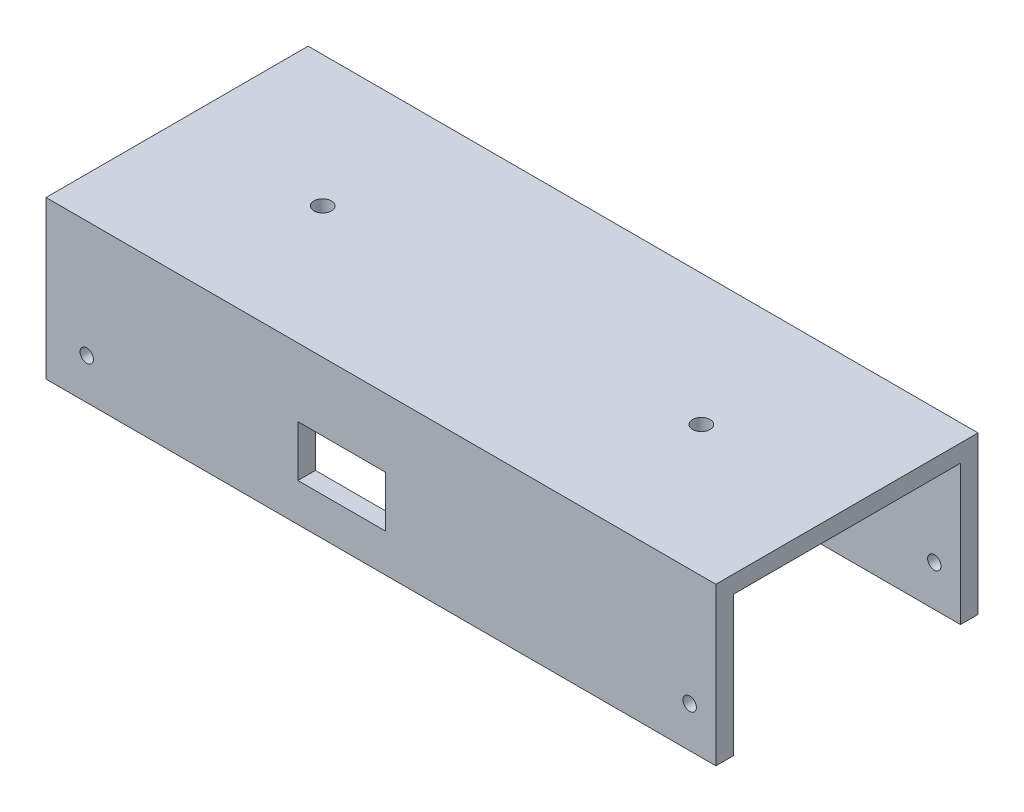
from build123d import *

# Parameters (mm, degrees)
SKETCH1_W           = 115
SKETCH1_H           = 27
BOSS_EXTRUDE5_DEPTH = 45
SHELL9_T            = -3
SKETCH3_R           = 1.15
CUT_EXTRUDE2_DEPTH  = 79
CUT_EXTRUDE8_DEPTH  = 23
SKETCH7_W           = 15
SKETCH7_H           = 8.75
CUT_EXTRUDE9_DEPTH  = 20
CUT_EXTRUDE10_DEPTH = 1
SKETCH10_R          = 1.5
CUT_EXTRUDE11_DEPTH = 26


with BuildPart() as part:
    # Sketch1 → Boss-Extrude5 (new body)
    with BuildSketch(Plane.XY):
        with Locations((57.5, 13.5)):
            Rectangle(SKETCH1_W, SKETCH1_H)
    extrude(amount=BOSS_EXTRUDE5_DEPTH)

    # Shell9
    shell9_openings = [part.faces().sort_by_distance(p)[0] for p in [
        (115, 13.5, 22.5),
        (57.5, 0, 22.5),
        (0, 13.5, 22.5),
    ]]
    offset(amount=SHELL9_T, openings=shell9_openings, kind=Kind.INTERSECTION)

    # Sketch3 → Cut-Extrude2 (cut)
    with BuildSketch(Plane(origin=(0, 0, 0), x_dir=(-1, 0, 0), z_dir=(0, 0, -1))):
        with Locations((-7, 7)):
            Circle(SKETCH3_R)
        with Locations((-110.5, 7)):
            Circle(SKETCH3_R)
    extrude(amount=-CUT_EXTRUDE2_DEPTH, mode=Mode.SUBTRACT)

    # Sketch6 → Cut-Extrude8 (cut)
    with BuildSketch(Plane(origin=(0, 0, 0), x_dir=(-1, 0, 0), z_dir=(0, 0, -1))):
        with BuildLine():
            Line((-46.883496676, 21.743762355), (-71.973496676, 21.743762355))
            ThreePointArc((-71.973496676, 21.743762355), (-73.723496676, 19.993762355), (-71.973496676, 18.243762355))
            Line((-71.973496676, 18.243762355), (-46.883496676, 18.243762355))
            ThreePointArc((-46.883496676, 18.243762355), (-45.133496676, 19.993762355), (-46.883496676, 21.743762355))
        make_face()
        with BuildLine():
            Line((-14.873496676, 15.993762355), (-89.873496676, 15.993762355))
            ThreePointArc((-89.873496676, 15.993762355), (-94.373496676, 11.493762355), (-89.873496676, 6.993762355))
            Line((-89.873496676, 6.993762355), (-14.873496676, 6.993762355))
            ThreePointArc((-14.873496676, 6.993762355), (-10.373496676, 11.493762355), (-14.873496676, 15.993762355))
        make_face()
        with BuildLine():
            ThreePointArc((-71.973496676, 4.743762355), (-73.723496676, 2.993762355), (-71.973496676, 1.243762355))
            Line((-71.973496676, 1.243762355), (-46.883496676, 1.243762355))
            ThreePointArc((-46.883496676, 1.243762355), (-45.133496676, 2.993762355), (-46.883496676, 4.743762355))
            Line((-46.883496676, 4.743762355), (-71.973496676, 4.743762355))
        make_face()
    extrude(amount=-CUT_EXTRUDE8_DEPTH, mode=Mode.SUBTRACT)

    # Sketch7 → Cut-Extrude9 (cut)
    with BuildSketch(Plane.XY.offset(45)):
        with Locations((50.746172795, 10.921245049)):
            Rectangle(SKETCH7_W, SKETCH7_H)
    extrude(amount=-CUT_EXTRUDE9_DEPTH, mode=Mode.SUBTRACT)

    # Sketch9 → Cut-Extrude10 (cut)
    # profile 1 of 6: a face of its own
    with BuildSketch(Plane.XZ.offset(-24)):
        with BuildLine():
            Line((2.360897436, 22.428821238), (2.645833333, 22.428821238))
            Line((2.645833333, 22.428821238), (2.645833333, 20.587550205))
            add(Edge.make_bspline(
                [(2.645833333, 20.587550205), (2.645582016, 20.54832753), (2.645096913, 20.472618319), (2.641603532, 20.363145879), (2.634236918, 20.262030216), (2.625883329, 20.168810167), (2.613866664, 20.083917824), (2.599192388, 20.007099874), (2.582650022, 19.9382826), (2.568117397, 19.895896494), (2.561242989, 19.875846479)],
                knots=[0, 0, 0, 0, 1.307562039, 2.523909702, 3.650326591, 4.686913197, 5.643429486, 6.506965704, 7.293745905, 8, 8, 8, 8], degree=3))
            add(Edge.make_bspline(
                [(2.561242989, 19.875846479), (2.551092751, 19.849784336), (2.53109576, 19.79843929), (2.493643793, 19.725655299), (2.451703037, 19.657123932), (2.403799771, 19.593227101), (2.350150613, 19.534285573), (2.292019545, 19.479018802), (2.228274443, 19.428596022), (2.158951754, 19.383887216), (2.085649501, 19.343621817), (2.008409823, 19.308745288), (1.927668268, 19.278367937), (1.842666359, 19.255614258), (1.754736789, 19.235897762), (1.662845548, 19.223066511), (1.567529511, 19.214333394), (1.502718345, 19.213525826), (1.469836739, 19.21311611)],
                knots=[0, 0, 0, 0, 0.981931301, 1.934503488, 2.87077864, 3.801706999, 4.735015492, 5.667491629, 6.616593066, 7.585388521, 8.561939025, 9.551802639, 10.560317337, 11.588439944, 12.640189604, 13.723962949, 14.845264515, 16, 16, 16, 16], degree=3))
            add(Edge.make_bspline(
                [(1.469836739, 19.21311611), (1.42186273, 19.213893065), (1.3281566, 19.215410667), (1.191536357, 19.233091711), (1.061783432, 19.258087464), (0.940612318, 19.295920245), (0.82878873, 19.342218085), (0.727076357, 19.395372079), (0.636388281, 19.45632238), (0.554633235, 19.525719354), (0.480844793, 19.608236408), (0.411423608, 19.705481074), (0.344602611, 19.818934609), (0.305442489, 19.902203713), (0.284935897, 19.945808418)],
                knots=[0, 0, 0, 0, 1.157897085, 2.2616841, 3.32207898, 4.345638746, 5.321241055, 6.241986252, 7.112515963, 7.955008012, 8.825025602, 9.77857164, 10.836726669, 12, 12, 12, 12], degree=3))
            Line((0.284935897, 19.945808418), (0.569871795, 19.945808418))
            add(Edge.make_bspline(
                [(0.569871795, 19.945808418), (0.592788228, 19.909426659), (0.637587032, 19.838304801), (0.721360297, 19.746217866), (0.813168893, 19.667520171), (0.916111177, 19.604101112), (1.030615479, 19.556285801), (1.156750687, 19.522199639), (1.295543201, 19.501792312), (1.392170438, 19.499332781), (1.442487981, 19.498052008)],
                knots=[0, 0, 0, 0, 0.997731894, 1.950442991, 2.880492273, 3.800895997, 4.748200782, 5.754801363, 6.83083817, 8, 8, 8, 8], degree=3))
            add(Edge.make_bspline(
                [(1.442487981, 19.498052008), (1.492169374, 19.499349357), (1.587950128, 19.501850516), (1.725682688, 19.522208747), (1.851408096, 19.556293219), (1.964401993, 19.604016541), (2.063331154, 19.662482267), (2.14861346, 19.72779662), (2.217687559, 19.801439387), (2.264145036, 19.869277168), (2.293023582, 19.929714772), (2.311413397, 19.981741769), (2.326357641, 20.040572594), (2.338857922, 20.106010012), (2.349172965, 20.178147515), (2.355707008, 20.257150045), (2.360429423, 20.342838054), (2.360737824, 20.402249687), (2.360897436, 20.432997921)],
                knots=[0, 0, 0, 0, 1.570740765, 3.028230971, 4.391408896, 5.680370741, 6.894727393, 8.017376726, 9.065722033, 10.075533815, 10.603371122, 11.180248986, 11.817768598, 12.521299649, 13.286540596, 14.121245857, 15.027658897, 16, 16, 16, 16], degree=3))
            Line((2.360897436, 20.432997921), (2.360897436, 20.553205253))
            add(Edge.make_bspline(
                [(2.360897436, 20.553205253), (2.331976708, 20.518786618), (2.274643959, 20.450554761), (2.175631741, 20.361145277), (2.067484967, 20.28414143), (1.950387754, 20.220987383), (1.82720842, 20.170476376), (1.699281111, 20.135149548), (1.567752604, 20.112325924), (1.478623868, 20.109870002), (1.433583734, 20.108628931)],
                knots=[0, 0, 0, 0, 1.012485704, 2.007162095, 2.997754123, 3.998611389, 4.999708251, 5.992315798, 6.98544096, 8, 8, 8, 8], degree=3))
            add(Edge.make_bspline(
                [(1.433583734, 20.108628931), (1.407062261, 20.109096133), (1.35433317, 20.110025009), (1.275997077, 20.1181519), (1.198816965, 20.129943617), (1.122972834, 20.147253208), (1.048355242, 20.169470703), (0.975087498, 20.197244458), (0.902576371, 20.228645316), (0.832139905, 20.265632073), (0.764479629, 20.306782166), (0.700105882, 20.351358159), (0.63935585, 20.399126749), (0.582807749, 20.450558973), (0.530535754, 20.505580392), (0.481836817, 20.563604473), (0.437516224, 20.625441445), (0.396664506, 20.689963757), (0.361233728, 20.757601166), (0.330132905, 20.82688701), (0.303091517, 20.89767314), (0.281532902, 20.970196547), (0.265067249, 21.044411509), (0.252811543, 21.120196444), (0.24586017, 21.197784725), (0.244776203, 21.25005552), (0.244230769, 21.276357296)],
                knots=[0, 0, 0, 0, 1.028754217, 2.045334182, 3.052854819, 4.056607503, 5.061168794, 6.071104265, 7.095078842, 8.125279047, 9.155117945, 10.165957491, 11.161587969, 12.151493252, 13.128948131, 14.104219989, 15.088194871, 16.07871515, 17.064853787, 18.047899887, 19.02414258, 20.002704429, 20.980574569, 21.971845993, 22.979467364, 24, 24, 24, 24], degree=3))
            add(Edge.make_bspline(
                [(0.244230769, 21.276357296), (0.244701727, 21.302667247), (0.245641819, 21.355185248), (0.253761636, 21.433090119), (0.265344208, 21.509951821), (0.283675541, 21.584978107), (0.305739544, 21.659023417), (0.333065927, 21.731540831), (0.365921516, 21.802552436), (0.403123218, 21.872110818), (0.444928073, 21.939282583), (0.490768252, 22.003078897), (0.540699095, 22.06303031), (0.594031762, 22.119741636), (0.651417453, 22.172665705), (0.712826482, 22.221674066), (0.777653523, 22.267588218), (0.846099493, 22.309417788), (0.917108266, 22.346413112), (0.988875801, 22.380170253), (1.062352772, 22.406961919), (1.136169289, 22.430568587), (1.211625355, 22.447291943), (1.287795776, 22.460193548), (1.364941326, 22.468053688), (1.416605737, 22.46903484), (1.442487981, 22.469526366)],
                knots=[0, 0, 0, 0, 1.008818848, 2.013730394, 3.001654427, 3.987803273, 4.973046549, 5.963777569, 6.957074694, 7.972068341, 8.987420212, 9.989399531, 10.982630087, 11.977756091, 12.973280677, 13.973972381, 14.989194003, 16.018387222, 17.047741039, 18.059210846, 19.057554164, 20.045176975, 21.029480261, 22.018708529, 23.007435371, 24, 24, 24, 24], degree=3))
            add(Edge.make_bspline(
                [(1.442487981, 22.469526366), (1.485169904, 22.46829567), (1.569453588, 22.465865423), (1.69348814, 22.446796241), (1.8131786, 22.416394243), (1.929200372, 22.372837207), (2.042498569, 22.313373958), (2.152699785, 22.235048569), (2.260122857, 22.137158475), (2.326414889, 22.062089805), (2.360897436, 22.023041991)],
                knots=[0, 0, 0, 0, 0.96728863, 1.910097829, 2.838038873, 3.762875196, 4.71315279, 5.730631239, 6.819562287, 8, 8, 8, 8], degree=3))
            Line((2.360897436, 22.023041991), (2.360897436, 22.428821238))
        make_face()
        with BuildLine():
            add(Edge.make_bspline(
                [(1.465384615, 22.184590469), (1.423718905, 22.18317436), (1.341229635, 22.180370763), (1.220318067, 22.156436059), (1.103589706, 22.118929421), (0.99327621, 22.06527862), (0.889946189, 21.999878847), (0.798256888, 21.920648729), (0.718060999, 21.830164679), (0.650222191, 21.729244812), (0.596218737, 21.620367462), (0.557988635, 21.505604153), (0.533268971, 21.386809267), (0.530540601, 21.305735549), (0.529166667, 21.264908979)],
                knots=[0, 0, 0, 0, 1.026226791, 2.031711442, 3.026614839, 4.04107745, 5.047145931, 6.032893242, 7.017642609, 8.019221815, 9.021877557, 10.003543541, 10.994637589, 12, 12, 12, 12], degree=3))
            add(Edge.make_bspline(
                [(0.529166667, 21.264908979), (0.529825032, 21.234126653), (0.531119843, 21.17358682), (0.543569089, 21.084743158), (0.563690393, 21.000124588), (0.59220843, 20.919725991), (0.627544089, 20.843086213), (0.671987169, 20.770733193), (0.724284836, 20.702602495), (0.784027757, 20.639198034), (0.849864903, 20.581448441), (0.921274462, 20.530704647), (0.998159582, 20.489202207), (1.078629331, 20.453333019), (1.164636231, 20.427135579), (1.254941473, 20.407143258), (1.350183941, 20.395705313), (1.415109733, 20.394287632), (1.448212139, 20.393564828)],
                knots=[0, 0, 0, 0, 1.039728707, 2.044842319, 3.024901384, 3.974314358, 4.923051295, 5.871625912, 6.837440708, 7.820715446, 8.810779094, 9.792721783, 10.773906224, 11.758876063, 12.764959493, 13.806266761, 14.881525401, 16, 16, 16, 16], degree=3))
            add(Edge.make_bspline(
                [(1.448212139, 20.393564828), (1.481743549, 20.394261159), (1.547313864, 20.395622827), (1.643081785, 20.407328144), (1.733825771, 20.426216651), (1.819462617, 20.453034538), (1.900315662, 20.487253555), (1.975476634, 20.530557486), (2.046557126, 20.579873792), (2.111287583, 20.637397548), (2.169820219, 20.700793222), (2.220829558, 20.769776806), (2.264294808, 20.843310276), (2.300288123, 20.921385346), (2.327766572, 21.004608766), (2.346198722, 21.092772489), (2.359086269, 21.185454131), (2.360284536, 21.248961947), (2.360897436, 21.281445437)],
                knots=[0, 0, 0, 0, 1.121943988, 2.193949579, 3.223793937, 4.220241907, 5.192961521, 6.155822191, 7.11847367, 8.083710714, 9.04790392, 10.001595906, 10.949595423, 11.902125208, 12.873731292, 13.87582262, 14.913508608, 16, 16, 16, 16], degree=3))
            add(Edge.make_bspline(
                [(2.360897436, 21.281445437), (2.359682256, 21.32373449), (2.357308222, 21.40635244), (2.334904372, 21.526736436), (2.298781753, 21.639919448), (2.24812077, 21.745543511), (2.184637091, 21.84248946), (2.10817325, 21.928961805), (2.020047922, 22.005071868), (1.920514302, 22.068479514), (1.813428406, 22.11970173), (1.701377035, 22.158129909), (1.584526545, 22.179896181), (1.505327159, 22.1830167), (1.465384615, 22.184590469)],
                knots=[0, 0, 0, 0, 1.070913519, 2.092188694, 3.091357305, 4.074328408, 5.051968682, 6.018948707, 6.99050112, 7.9935919, 9.000589572, 9.992915277, 10.987769056, 12, 12, 12, 12], degree=3))
        make_face(mode=Mode.SUBTRACT)
    # profile 2 of 6: a face of its own
    with BuildSketch(Plane.XZ.offset(-24)):
        with BuildLine():
            Line((3.215705128, 22.428821238), (3.500641026, 22.428821238))
            Line((3.500641026, 22.428821238), (3.500641026, 22.087279772))
            add(Edge.make_bspline(
                [(3.500641026, 22.087279772), (3.521676543, 22.119080416), (3.561906805, 22.179898901), (3.628774962, 22.260334624), (3.69726727, 22.326932559), (3.767711619, 22.380003609), (3.840626038, 22.419748366), (3.914410273, 22.448861334), (3.990225163, 22.46607647), (4.041172051, 22.468374861), (4.066696715, 22.469526366)],
                knots=[0, 0, 0, 0, 1.2804753, 2.448899062, 3.506932113, 4.484331642, 5.4025378, 6.288909075, 7.142734305, 8, 8, 8, 8], degree=3))
            add(Edge.make_bspline(
                [(4.066696715, 22.469526366), (4.086496311, 22.468446389), (4.127235267, 22.466224264), (4.188905188, 22.450611588), (4.252444605, 22.425685096), (4.293395199, 22.402244323), (4.31474359, 22.390024163)],
                knots=[0, 0, 0, 0, 0.901110191, 1.854092781, 2.881294221, 4, 4, 4, 4], degree=3))
            Line((4.31474359, 22.390024163), (4.158283253, 22.143249323))
            add(Edge.make_bspline(
                [(4.158283253, 22.143249323), (4.144577213, 22.149363707), (4.118560524, 22.160969979), (4.080501739, 22.174705946), (4.04541224, 22.182793955), (4.023057012, 22.184019249), (4.012635216, 22.184590469)],
                knots=[0, 0, 0, 0, 1.180555205, 2.24091978, 3.179933427, 4, 4, 4, 4], degree=3))
            add(Edge.make_bspline(
                [(4.012635216, 22.184590469), (3.989770015, 22.183066435), (3.943131633, 22.179957848), (3.874656408, 22.155520501), (3.808210729, 22.11603689), (3.755440721, 22.072248096), (3.714580963, 22.030022594), (3.685425187, 21.993148686), (3.658680124, 21.951802356), (3.63312571, 21.906690428), (3.609842714, 21.857042639), (3.588112407, 21.80335501), (3.568464724, 21.745565357), (3.557261289, 21.705304071), (3.551522436, 21.684680613)],
                knots=[0, 0, 0, 0, 1.125678352, 2.296057538, 3.5422874, 4.923748041, 5.663163013, 6.437101912, 7.23742474, 8.08941207, 8.991984279, 9.93940061, 10.944477711, 12, 12, 12, 12], degree=3))
            add(Edge.make_bspline(
                [(3.551522436, 21.684680613), (3.547229479, 21.66628632), (3.537720906, 21.625544358), (3.528475725, 21.557192482), (3.519341234, 21.476435306), (3.512903587, 21.38304804), (3.506936363, 21.277263894), (3.503570789, 21.158921715), (3.500755797, 21.027900032), (3.500680443, 20.936301869), (3.500641026, 20.888386543)],
                knots=[0, 0, 0, 0, 0.566838948, 1.255505196, 2.06880316, 3.007127437, 4.065329342, 5.249902469, 6.561414163, 8, 8, 8, 8], degree=3))
            Line((3.500641026, 20.888386543), (3.500641026, 20.108628931))
            Line((3.500641026, 20.108628931), (3.215705128, 20.108628931))
            Line((3.215705128, 20.108628931), (3.215705128, 22.428821238))
        make_face()
    # profile 3 of 6: a face of its own
    with BuildSketch(Plane.XZ.offset(-24)):
        with BuildLine():
            add(Edge.make_bspline(
                [(5.720342548, 22.469526366), (5.763877488, 22.468599365), (5.849238867, 22.466781742), (5.974250306, 22.447355309), (6.093580537, 22.417648772), (6.207686583, 22.376580997), (6.315107079, 22.321533799), (6.417406708, 22.255848228), (6.514304994, 22.178031161), (6.572383028, 22.117834913), (6.601862981, 22.087279772)],
                knots=[0, 0, 0, 0, 1.054011418, 2.066658804, 3.057071809, 4.030435133, 4.997543892, 5.974964718, 6.972108034, 8, 8, 8, 8], degree=3))
            add(Edge.make_bspline(
                [(6.601862981, 22.087279772), (6.627246611, 22.058057085), (6.677522627, 22.00017725), (6.741989386, 21.90632823), (6.797526087, 21.809136853), (6.842033202, 21.707312492), (6.877126045, 21.60174404), (6.902041355, 21.492068645), (6.916861289, 21.378528515), (6.918859694, 21.301417891), (6.919871795, 21.262364908)],
                knots=[0, 0, 0, 0, 1.025258237, 2.030674902, 3.01204498, 3.988269485, 4.97094183, 5.956517959, 6.965070386, 8, 8, 8, 8], degree=3))
            add(Edge.make_bspline(
                [(6.919871795, 21.262364908), (6.918981582, 21.22308557), (6.917222479, 21.145467766), (6.900582198, 21.031150199), (6.874700428, 20.920302038), (6.837660117, 20.813387366), (6.790163833, 20.710079373), (6.732205852, 20.610829281), (6.663379456, 20.515441275), (6.585361545, 20.424725322), (6.499135914, 20.341117398), (6.405594837, 20.268248182), (6.306576535, 20.205817228), (6.20076435, 20.155528479), (6.089124558, 20.115877537), (5.971416361, 20.088028236), (5.847822619, 20.071190138), (5.763433639, 20.069027896), (5.720342548, 20.067923802)],
                knots=[0, 0, 0, 0, 0.998656419, 1.973391657, 2.932242238, 3.890759089, 4.846373663, 5.82037756, 6.809684879, 7.83454468, 8.860553229, 9.859544525, 10.845671541, 11.83227036, 12.833544569, 13.85385346, 14.904124723, 16, 16, 16, 16], degree=3))
            add(Edge.make_bspline(
                [(5.720342548, 20.067923802), (5.677040338, 20.069031602), (5.592230773, 20.071201283), (5.468200775, 20.087962818), (5.35028162, 20.115864702), (5.238495677, 20.155658785), (5.132228566, 20.205818835), (5.03263653, 20.268059439), (4.939019464, 20.341139009), (4.852775592, 20.424719466), (4.774762571, 20.515442784), (4.705934914, 20.61082889), (4.647977261, 20.710079475), (4.60048089, 20.813387339), (4.563440603, 20.920302045), (4.537558826, 21.031150197), (4.520918547, 21.145467767), (4.519159444, 21.22308557), (4.518269231, 21.262364908)],
                knots=[0, 0, 0, 0, 1.099876186, 2.154163076, 3.173186993, 4.173200201, 5.163417411, 6.152872554, 7.150605724, 8.17532212, 9.198891216, 10.186952605, 11.159729845, 12.11414092, 13.071450619, 14.029093627, 15.002601286, 16, 16, 16, 16], degree=3))
            add(Edge.make_bspline(
                [(4.518269231, 21.262364908), (4.519288234, 21.301205632), (4.521305684, 21.37810359), (4.536110718, 21.491430281), (4.560928837, 21.600920055), (4.596063746, 21.706081022), (4.640981098, 21.807459168), (4.695737409, 21.904890693), (4.760861769, 21.998315341), (4.810937825, 22.056120371), (4.836278045, 22.085371719)],
                knots=[0, 0, 0, 0, 1.031353054, 2.041901799, 3.029428768, 4.008703097, 4.981709435, 5.96992636, 6.972712378, 8, 8, 8, 8], degree=3))
            add(Edge.make_bspline(
                [(4.836278045, 22.085371719), (4.865713552, 22.116191843), (4.923603658, 22.176805038), (5.020984289, 22.254395257), (5.123032255, 22.321447695), (5.231639867, 22.375401119), (5.345652174, 22.417890346), (5.465593915, 22.44743192), (5.591029561, 22.466711749), (5.676808646, 22.468578811), (5.720342548, 22.469526366)],
                knots=[0, 0, 0, 0, 1.027980169, 2.021703884, 2.998553061, 3.971491411, 4.943284454, 5.930300938, 6.949603206, 8, 8, 8, 8], degree=3))
        make_face()
        with BuildLine():
            add(Edge.make_bspline(
                [(5.719070513, 22.184590469), (5.688284251, 22.183715447), (5.62750647, 22.18198799), (5.538044418, 22.16884902), (5.451920136, 22.148032355), (5.368970227, 22.118455818), (5.289474421, 22.080266103), (5.213356606, 22.033359233), (5.140392892, 21.97835648), (5.072010592, 21.915343914), (5.009252352, 21.846510826), (4.954390187, 21.773169814), (4.907740269, 21.696510486), (4.868878125, 21.616453123), (4.839933747, 21.532186433), (4.818912506, 21.444664718), (4.80578593, 21.353709661), (4.804074715, 21.291877881), (4.803205128, 21.260456855)],
                knots=[0, 0, 0, 0, 1.021534396, 2.016698045, 2.994645724, 3.958388632, 4.93408049, 5.916473867, 6.921342795, 7.962252576, 8.998418191, 10.008913653, 10.997312074, 11.973003931, 12.956656626, 13.948281152, 14.957379055, 16, 16, 16, 16], degree=3))
            add(Edge.make_bspline(
                [(4.803205128, 21.260456855), (4.804662747, 21.219860373), (4.807555847, 21.139283948), (4.831082812, 21.020619573), (4.870440365, 20.906698893), (4.923587398, 20.798189743), (4.990177325, 20.697794176), (5.06863345, 20.608285044), (5.158113749, 20.531009343), (5.257551574, 20.466891719), (5.364915848, 20.415946798), (5.478541225, 20.379843442), (5.597050998, 20.356374121), (5.678041375, 20.354041426), (5.719070513, 20.3528597)],
                knots=[0, 0, 0, 0, 1.016792936, 2.018143844, 3.017858371, 4.030088057, 5.03801393, 6.028138512, 7.003788237, 7.991172063, 8.984598303, 9.972568034, 10.972917682, 12, 12, 12, 12], degree=3))
            add(Edge.make_bspline(
                [(5.719070513, 20.3528597), (5.76009729, 20.354048311), (5.84108301, 20.356394597), (5.95942812, 20.379725241), (6.072742937, 20.41610499), (6.179995696, 20.466834423), (6.279388258, 20.531252828), (6.369512103, 20.607848684), (6.447298344, 20.69803125), (6.513822399, 20.798322722), (6.567839802, 20.90653067), (6.607013135, 21.020640599), (6.630596659, 21.139278594), (6.633482125, 21.219858579), (6.634935897, 21.260456855)],
                knots=[0, 0, 0, 0, 1.02726834, 2.027799167, 3.010890988, 4.004497153, 4.992059811, 5.971914811, 6.958719428, 7.966827853, 8.981595046, 9.981490638, 10.983022906, 12, 12, 12, 12], degree=3))
            add(Edge.make_bspline(
                [(6.634935897, 21.260456855), (6.63406661, 21.291878068), (6.632355984, 21.353710219), (6.619225123, 21.444662587), (6.598219741, 21.53219425), (6.569216917, 21.616424282), (6.530523633, 21.696717768), (6.482974113, 21.772944734), (6.428335969, 21.846764887), (6.364820438, 21.915121404), (6.296509516, 21.978381044), (6.223516232, 22.033380562), (6.147511287, 22.080059952), (6.06824643, 22.11878247), (5.985285886, 22.147763272), (5.899282276, 22.168969216), (5.810201927, 22.181932466), (5.749641938, 22.183698801), (5.719070513, 22.184590469)],
                knots=[0, 0, 0, 0, 1.042956736, 2.052379634, 3.044323526, 4.02829302, 5.004299113, 5.996692471, 7.007513377, 8.048758398, 9.090003419, 10.095195979, 11.07790575, 12.047570684, 13.018257071, 13.989683339, 14.985167495, 16, 16, 16, 16], degree=3))
        make_face(mode=Mode.SUBTRACT)
    # profile 4 of 6: a face of its own
    with BuildSketch(Plane.XZ.offset(-24)):
        with BuildLine():
            Line((7.449038462, 22.428821238), (7.733974359, 22.428821238))
            Line((7.733974359, 22.428821238), (7.733974359, 21.352679411))
            add(Edge.make_bspline(
                [(7.733974359, 21.352679411), (7.734103087, 21.321090203), (7.734349338, 21.260661528), (7.736019334, 21.17370718), (7.739947348, 21.094407733), (7.74485846, 21.022717379), (7.751174112, 20.958648245), (7.758688303, 20.902424114), (7.767087014, 20.85340739), (7.77530819, 20.823885917), (7.779131611, 20.810156375)],
                knots=[0, 0, 0, 0, 1.388932606, 2.656963016, 3.823490214, 4.879454478, 5.816252168, 6.653371382, 7.373723809, 8, 8, 8, 8], degree=3))
            add(Edge.make_bspline(
                [(7.779131611, 20.810156375), (7.785265216, 20.792899913), (7.797404911, 20.758745748), (7.819424429, 20.70940715), (7.84666442, 20.663709572), (7.876472978, 20.619890878), (7.910853155, 20.579249075), (7.949369961, 20.541852797), (7.990734076, 20.506289086), (8.052197561, 20.464211453), (8.136252752, 20.419112547), (8.246609181, 20.380199911), (8.366265157, 20.35694456), (8.448964581, 20.354246486), (8.491471354, 20.3528597)],
                knots=[0, 0, 0, 0, 0.725840625, 1.436591201, 2.137033971, 2.831655856, 3.53531722, 4.242432219, 4.957935707, 5.694543706, 7.190802206, 8.724350549, 10.316345118, 12, 12, 12, 12], degree=3))
            add(Edge.make_bspline(
                [(8.491471354, 20.3528597), (8.533974179, 20.354275975), (8.616209281, 20.357016206), (8.734550575, 20.379498416), (8.842728643, 20.417059291), (8.939657721, 20.469498872), (9.024898161, 20.533672029), (9.095931455, 20.608972877), (9.154539465, 20.693019107), (9.180129439, 20.755724702), (9.192998798, 20.78725974)],
                knots=[0, 0, 0, 0, 1.157059328, 2.238695713, 3.266970494, 4.264342957, 5.228770407, 6.160125903, 7.074715775, 8, 8, 8, 8], degree=3))
            add(Edge.make_bspline(
                [(9.192998798, 20.78725974), (9.196803564, 20.799929168), (9.205214972, 20.827938179), (9.214252248, 20.875454094), (9.222393367, 20.932118414), (9.229344962, 20.998301932), (9.234302645, 21.073831691), (9.236975112, 21.158684089), (9.239994334, 21.252592751), (9.240040159, 21.318331362), (9.240064103, 21.352679411)],
                knots=[0, 0, 0, 0, 0.557542046, 1.232589297, 2.036731608, 2.971723315, 4.038036528, 5.22795436, 6.551621927, 8, 8, 8, 8], degree=3))
            Line((9.240064103, 21.352679411), (9.240064103, 22.428821238))
            Line((9.240064103, 22.428821238), (9.525, 22.428821238))
            Line((9.525, 22.428821238), (9.525, 21.299253931))
            add(Edge.make_bspline(
                [(9.525, 21.299253931), (9.52459932, 21.260875282), (9.523821945, 21.186415454), (9.518825998, 21.078207725), (9.510253849, 20.977367688), (9.497242985, 20.883841967), (9.481943409, 20.797701966), (9.462207361, 20.718837283), (9.438641388, 20.647490902), (9.4120571, 20.582410861), (9.38065012, 20.523404036), (9.347242751, 20.467400831), (9.308666708, 20.415790811), (9.26805371, 20.366004872), (9.222876494, 20.320519344), (9.173981622, 20.278290505), (9.122057291, 20.238672826), (9.065951233, 20.203211451), (9.006482518, 20.171264923), (8.943577734, 20.142947481), (8.8764664, 20.120538715), (8.806014386, 20.101206896), (8.731876522, 20.086044485), (8.65412428, 20.075352385), (8.572783849, 20.068797978), (8.517348839, 20.068220087), (8.488927284, 20.067923802)],
                knots=[0, 0, 0, 0, 1.493040784, 2.896703357, 4.213163133, 5.428574705, 6.569057535, 7.615249723, 8.588095153, 9.490268104, 10.346124644, 11.18633936, 12.024365274, 12.850166724, 13.684164916, 14.514361689, 15.362232829, 16.222528818, 17.093394965, 17.986930858, 18.902426812, 19.842810585, 20.827885679, 21.843828298, 22.894529745, 24, 24, 24, 24], degree=3))
            add(Edge.make_bspline(
                [(8.488927284, 20.067923802), (8.460718303, 20.068231965), (8.40528503, 20.068837534), (8.323940401, 20.075316174), (8.245972737, 20.086027872), (8.171659233, 20.101317962), (8.100925315, 20.120403404), (8.033484469, 20.143085182), (7.97012638, 20.171279619), (7.910089847, 20.203009261), (7.853844824, 20.238900618), (7.801132042, 20.278241625), (7.752022183, 20.320973554), (7.706504414, 20.366917942), (7.665217643, 20.416644734), (7.627647376, 20.469753921), (7.593215222, 20.525719273), (7.562052334, 20.585647999), (7.535280956, 20.651481179), (7.511645125, 20.724322117), (7.492313332, 20.8049694), (7.476581236, 20.893354078), (7.463925286, 20.989053152), (7.455138571, 21.092620214), (7.450225639, 21.203802992), (7.449442719, 21.280592535), (7.449038462, 21.320242512)],
                knots=[0, 0, 0, 0, 1.083640291, 2.129454052, 3.13281866, 4.105697902, 5.042300162, 5.946461698, 6.836384745, 7.703652036, 8.553297018, 9.397182691, 10.228592656, 11.052265423, 11.879314572, 12.708807002, 13.549817954, 14.402308542, 15.300838682, 16.27712199, 17.341985831, 18.484375296, 19.725102775, 21.0496083, 22.476576903, 24, 24, 24, 24], degree=3))
            Line((7.449038462, 21.320242512), (7.449038462, 22.428821238))
        make_face()
    # profile 5 of 6: a face of its own
    with BuildSketch(Plane.XZ.offset(-24)):
        with BuildLine():
            Line((10.176282051, 22.428821238), (10.461217949, 22.428821238))
            Line((10.461217949, 22.428821238), (10.461217949, 21.999509339))
            add(Edge.make_bspline(
                [(10.461217949, 21.999509339), (10.491477952, 22.038459998), (10.550282213, 22.114152808), (10.651632662, 22.212115282), (10.758609125, 22.294733593), (10.873964506, 22.359487748), (10.995905996, 22.408310913), (11.12393317, 22.444396557), (11.259132621, 22.465661323), (11.35156726, 22.468220973), (11.398707933, 22.469526366)],
                knots=[0, 0, 0, 0, 1.0828784, 2.104357462, 3.088488658, 4.04616522, 5.001424249, 5.969181776, 6.964304535, 8, 8, 8, 8], degree=3))
            add(Edge.make_bspline(
                [(11.398707933, 22.469526366), (11.439884601, 22.468335126), (11.52127245, 22.465980576), (11.641072665, 22.450039305), (11.756438906, 22.422718255), (11.866718497, 22.383347425), (11.973092849, 22.334674248), (12.073987183, 22.273245223), (12.170973051, 22.202119607), (12.261611308, 22.120266156), (12.345359977, 22.031703372), (12.41779187, 21.936433139), (12.480268526, 21.837588507), (12.530769438, 21.733637109), (12.570328439, 21.625397522), (12.598463182, 21.512432436), (12.615206902, 21.39516069), (12.617453397, 21.315420365), (12.618589744, 21.275085261)],
                knots=[0, 0, 0, 0, 1.041296284, 2.058176809, 3.050446431, 4.034000596, 5.01514041, 6.003636468, 7.015969324, 8.052561599, 9.08815499, 10.094063707, 11.074456064, 12.040834395, 13.011057502, 13.983766392, 14.980127149, 16, 16, 16, 16], degree=3))
            add(Edge.make_bspline(
                [(12.618589744, 21.275085261), (12.617478053, 21.233898881), (12.615285639, 21.152673396), (12.598281241, 21.033395815), (12.571106076, 20.918653697), (12.532046153, 20.808637894), (12.481571374, 20.703424153), (12.420153666, 20.603088351), (12.347685228, 20.507662635), (12.264862062, 20.418442504), (12.175006899, 20.336255984), (12.078960891, 20.264375735), (11.978214579, 20.204013202), (11.873283399, 20.153591517), (11.76326907, 20.115589322), (11.648684882, 20.08817746), (11.529593221, 20.07127331), (11.448584319, 20.069048867), (11.407612179, 20.067923802)],
                knots=[0, 0, 0, 0, 1.038740735, 2.04854663, 3.033179607, 4.009277356, 4.987731542, 5.972001279, 6.972200261, 8.005528982, 9.039189865, 10.040446548, 11.026516639, 11.997840187, 12.972163198, 13.956796175, 14.96660207, 16, 16, 16, 16], degree=3))
            add(Edge.make_bspline(
                [(11.407612179, 20.067923802), (11.361504311, 20.069098378), (11.270427752, 20.071418509), (11.137261294, 20.094931117), (11.009103007, 20.130071051), (10.887372759, 20.181505138), (10.771106243, 20.247051213), (10.660961133, 20.326979757), (10.556352365, 20.42112361), (10.493388706, 20.492544615), (10.461217949, 20.529036583)],
                knots=[0, 0, 0, 0, 1.014726462, 2.004382257, 2.969841629, 3.936926163, 4.907207904, 5.903978561, 6.929055279, 8, 8, 8, 8], degree=3))
            Line((10.461217949, 20.529036583), (10.461217949, 19.253821238))
            Line((10.461217949, 19.253821238), (10.176282051, 19.253821238))
            Line((10.176282051, 19.253821238), (10.176282051, 22.428821238))
        make_face()
        with BuildLine():
            add(Edge.make_bspline(
                [(11.396163862, 22.184590469), (11.363888116, 22.184009663), (11.300345492, 22.182866207), (11.207207122, 22.169282696), (11.117494841, 22.149563459), (11.032112785, 22.119707664), (10.950242583, 22.083060169), (10.872514805, 22.037265773), (10.798984011, 21.983152882), (10.729835205, 21.921758049), (10.66736636, 21.854108153), (10.612064276, 21.781910641), (10.565611935, 21.705256943), (10.52705653, 21.624861078), (10.497716553, 21.540092855), (10.476892435, 21.451435051), (10.463802044, 21.358790626), (10.462088508, 21.295693392), (10.461217949, 21.263636943)],
                knots=[0, 0, 0, 0, 1.05670511, 2.080379991, 3.077984906, 4.06214886, 5.038337365, 6.01289324, 7.01187578, 8.025460281, 9.038092164, 10.024533457, 11.000252242, 11.969694649, 12.940728589, 13.933144304, 14.949937299, 16, 16, 16, 16], degree=3))
            add(Edge.make_bspline(
                [(10.461217949, 21.263636943), (10.462661082, 21.221556298), (10.465488304, 21.139116751), (10.488472916, 21.018662583), (10.525879191, 20.904678582), (10.578973096, 20.798124641), (10.64605411, 20.700168783), (10.726878866, 20.61245659), (10.820716037, 20.535539411), (10.926005561, 20.470750131), (11.038874208, 20.418146671), (11.156608571, 20.380487351), (11.27758957, 20.357289687), (11.359385117, 20.354344358), (11.400615986, 20.3528597)],
                knots=[0, 0, 0, 0, 1.03728447, 2.032128127, 3.01272805, 3.987917167, 4.958271349, 5.931593992, 6.91984656, 7.941419022, 8.973179163, 9.983609215, 10.983593296, 12, 12, 12, 12], degree=3))
            add(Edge.make_bspline(
                [(11.400615986, 20.3528597), (11.441016289, 20.354271556), (11.521203629, 20.357073837), (11.63927564, 20.381329193), (11.754020719, 20.418381465), (11.863041304, 20.472410491), (11.965388325, 20.538622901), (12.057809448, 20.618052359), (12.138551434, 20.710118237), (12.207371242, 20.812633093), (12.262826232, 20.922556476), (12.304491521, 21.036295308), (12.328538584, 21.153448656), (12.331946528, 21.232368009), (12.333653846, 21.271905173)],
                knots=[0, 0, 0, 0, 1.00104056, 1.986885549, 2.97790532, 3.984399681, 4.995088187, 5.994304198, 6.996462723, 8.023150851, 9.048424203, 10.043036403, 11.019596776, 12, 12, 12, 12], degree=3))
            add(Edge.make_bspline(
                [(12.333653846, 21.271905173), (12.332334195, 21.311687913), (12.329705173, 21.390943445), (12.303808932, 21.507749793), (12.264892524, 21.621948171), (12.208142527, 21.730370384), (12.140831375, 21.832672588), (12.059418028, 21.922982178), (11.968144764, 22.002058431), (11.865919594, 22.067386696), (11.756209351, 22.119352823), (11.640716534, 22.157347267), (11.52002698, 22.180183454), (11.437814751, 22.183108542), (11.396163862, 22.184590469)],
                knots=[0, 0, 0, 0, 0.983928682, 1.960191568, 2.949917689, 3.96440592, 4.982380491, 5.975291189, 6.965713506, 7.964880129, 8.970154049, 9.96478489, 10.968906225, 12, 12, 12, 12], degree=3))
        make_face(mode=Mode.SUBTRACT)
    # profile 6 of 6: a face of its own
    with BuildSketch(Plane.XZ.offset(-24)):
        with BuildLine():
            Line((14.613141026, 22.550936623), (14.328205128, 22.550936623))
            add(Edge.make_bspline(
                [(14.328205128, 22.550936623), (14.335924506, 22.582897519), (14.351015259, 22.645378457), (14.382490915, 22.734647901), (14.416780239, 22.819124238), (14.457954641, 22.897225676), (14.502866154, 22.970521824), (14.554321766, 23.037350244), (14.609947514, 23.099410577), (14.671474432, 23.154486157), (14.73599829, 23.204358811), (14.804428266, 23.246881184), (14.875387606, 23.283460952), (14.949367948, 23.313596448), (15.026589546, 23.336298173), (15.106354276, 23.352768989), (15.188871165, 23.363465214), (15.244885051, 23.364509121), (15.273327324, 23.365039187)],
                knots=[0, 0, 0, 0, 1.162005537, 2.271625781, 3.343758855, 4.383309926, 5.390229558, 6.379919256, 7.361854164, 8.333198761, 9.295911338, 10.242430842, 11.177959212, 12.116337295, 13.062827104, 14.020064771, 14.994644689, 16, 16, 16, 16], degree=3))
            add(Edge.make_bspline(
                [(15.273327324, 23.365039187), (15.314768097, 23.363788028), (15.3967457, 23.361313002), (15.517180749, 23.338712049), (15.633319364, 23.302947822), (15.743890324, 23.253532369), (15.846595617, 23.192583878), (15.937977729, 23.120044438), (16.016798021, 23.037313643), (16.082923635, 22.945934817), (16.134698813, 22.84827589), (16.172877166, 22.747764319), (16.196119691, 22.644638531), (16.19913191, 22.575008713), (16.200641026, 22.540124323)],
                knots=[0, 0, 0, 0, 1.083050992, 2.142477498, 3.193116406, 4.255571735, 5.30263384, 6.308962982, 7.297363603, 8.282367274, 9.249857812, 10.179914175, 11.08814088, 12, 12, 12, 12], degree=3))
            add(Edge.make_bspline(
                [(16.200641026, 22.540124323), (16.199585482, 22.506553874), (16.197519948, 22.440861714), (16.179981515, 22.344957213), (16.150466477, 22.254568047), (16.109581763, 22.169313707), (16.056657643, 22.089734745), (15.992547411, 22.015652115), (15.916798567, 21.946737236), (15.859395531, 21.907258857), (15.829842748, 21.886934219)],
                knots=[0, 0, 0, 0, 1.024540389, 2.004866551, 2.965041327, 3.920577974, 4.882998113, 5.874504559, 6.905732034, 8, 8, 8, 8], degree=3))
            add(Edge.make_bspline(
                [(15.829842748, 21.886934219), (15.863617269, 21.870625449), (15.930534362, 21.838313059), (16.021748056, 21.774943908), (16.104550129, 21.701777078), (16.150727074, 21.6446791), (16.173928285, 21.615990709)],
                knots=[0, 0, 0, 0, 1.015518401, 2.012035669, 3.001164323, 4, 4, 4, 4], degree=3))
            add(Edge.make_bspline(
                [(16.173928285, 21.615990709), (16.189205789, 21.595074035), (16.219510616, 21.55358321), (16.256917136, 21.486875167), (16.290852547, 21.419427745), (16.31729596, 21.349433141), (16.337773682, 21.277702621), (16.352411368, 21.204113019), (16.361504696, 21.128604241), (16.362806947, 21.077520777), (16.363461538, 21.051843073)],
                knots=[0, 0, 0, 0, 1.025084078, 2.033381695, 3.024893161, 4.013698104, 4.991890475, 5.976764909, 6.982997093, 8, 8, 8, 8], degree=3))
            add(Edge.make_bspline(
                [(16.363461538, 21.051843073), (16.361833658, 21.007384255), (16.358585559, 20.918675842), (16.329553292, 20.78761663), (16.284546995, 20.659504924), (16.220632488, 20.536972749), (16.142738391, 20.422327689), (16.050067104, 20.319751323), (15.943671577, 20.231578303), (15.825012167, 20.157909025), (15.696454486, 20.099019195), (15.55895377, 20.058145658), (15.414491221, 20.031524644), (15.315424601, 20.028669984), (15.265059095, 20.027218674)],
                knots=[0, 0, 0, 0, 0.955779014, 1.907060117, 2.875433937, 3.871313158, 4.872415639, 5.851225146, 6.836215519, 7.83643374, 8.849228613, 9.86973379, 10.916971861, 12, 12, 12, 12], degree=3))
            add(Edge.make_bspline(
                [(15.265059095, 20.027218674), (15.231114444, 20.028006268), (15.16432269, 20.029555989), (15.066130373, 20.040150149), (14.972402832, 20.05949951), (14.883013339, 20.085537509), (14.797882485, 20.118550018), (14.717270047, 20.159660551), (14.640680072, 20.208021699), (14.568835309, 20.264204311), (14.501744323, 20.327052384), (14.441190066, 20.397681628), (14.386162968, 20.474786416), (14.338136431, 20.559262331), (14.29492291, 20.650017672), (14.259380185, 20.748214524), (14.228096848, 20.85297503), (14.213552205, 20.925979837), (14.206089744, 20.963436623)],
                knots=[0, 0, 0, 0, 1.048658725, 2.063410685, 3.046034179, 4.001477787, 4.936774919, 5.862367409, 6.792675028, 7.730719943, 8.675894397, 9.627829632, 10.600096036, 11.597688215, 12.626045268, 13.701542398, 14.82072376, 16, 16, 16, 16], degree=3))
            Line((14.206089744, 20.963436623), (14.491025641, 20.963436623))
            add(Edge.make_bspline(
                [(14.491025641, 20.963436623), (14.498449055, 20.938990018), (14.512888241, 20.891439248), (14.53746664, 20.823004114), (14.565468573, 20.76026788), (14.595508208, 20.702770333), (14.627057227, 20.649945225), (14.662358623, 20.603189387), (14.698797776, 20.560449168), (14.726265475, 20.536369413), (14.739708534, 20.524584459)],
                knots=[0, 0, 0, 0, 1.198163088, 2.33053128, 3.407730985, 4.417276592, 5.372219308, 6.28897303, 7.162600585, 8, 8, 8, 8], degree=3))
            add(Edge.make_bspline(
                [(14.739708534, 20.524584459), (14.757485428, 20.510879042), (14.792984344, 20.483510513), (14.850831239, 20.448584036), (14.911668671, 20.41832082), (14.97681484, 20.395203468), (15.044863953, 20.375629447), (15.11691592, 20.362820119), (15.192335067, 20.354031563), (15.243831539, 20.353256018), (15.270147236, 20.3528597)],
                knots=[0, 0, 0, 0, 0.946170439, 1.889420265, 2.845303464, 3.807233317, 4.801018734, 5.828864929, 6.890507805, 8, 8, 8, 8], degree=3))
            add(Edge.make_bspline(
                [(15.270147236, 20.3528597), (15.299859342, 20.353418414), (15.3579588, 20.354510931), (15.442735708, 20.364558179), (15.523387464, 20.379190769), (15.599018618, 20.401790403), (15.670619864, 20.429713033), (15.737187503, 20.464772658), (15.7995954, 20.505906798), (15.857044217, 20.552660177), (15.908701928, 20.603842534), (15.954185629, 20.65737582), (15.992852286, 20.713034322), (16.024043104, 20.771126046), (16.048672531, 20.831410432), (16.065439435, 20.894056656), (16.077097595, 20.958552033), (16.078047022, 21.002393312), (16.078525641, 21.024494315)],
                knots=[0, 0, 0, 0, 1.217147791, 2.380027433, 3.494444702, 4.572153297, 5.609568379, 6.639424714, 7.649109417, 8.668170816, 9.669597737, 10.625200337, 11.543417969, 12.441394052, 13.322311151, 14.205496177, 15.095365482, 16, 16, 16, 16], degree=3))
            add(Edge.make_bspline(
                [(16.078525641, 21.024494315), (16.077137439, 21.054077458), (16.074367942, 21.113096543), (16.053223731, 21.199926057), (16.018444904, 21.283585867), (15.969756269, 21.362648619), (15.910487429, 21.435923901), (15.841213549, 21.501303032), (15.761359371, 21.5552509), (15.687862775, 21.592524181), (15.622761526, 21.617957814), (15.567048999, 21.634898674), (15.504676937, 21.649243919), (15.436399607, 21.662590051), (15.361702546, 21.673948703), (15.280667077, 21.683420921), (15.193276779, 21.691000137), (15.132778364, 21.694384773), (15.101602564, 21.696128931)],
                knots=[0, 0, 0, 0, 1.07054697, 2.135767047, 3.216561865, 4.33974944, 5.486079747, 6.621378074, 7.775625952, 8.963672916, 9.598146892, 10.304877434, 11.070270905, 11.915000392, 12.823868403, 13.805723172, 14.86925407, 16, 16, 16, 16], degree=3))
            Line((15.101602564, 21.696128931), (15.101602564, 22.021769956))
            add(Edge.make_bspline(
                [(15.101602564, 22.021769956), (15.140882907, 22.022436528), (15.21782345, 22.023742179), (15.330213284, 22.039533731), (15.437685503, 22.061378301), (15.537858333, 22.09483844), (15.629161094, 22.133700709), (15.708372448, 22.178923785), (15.774382646, 22.229192879), (15.826870903, 22.285283889), (15.866358132, 22.34544111), (15.895229584, 22.408139793), (15.912284166, 22.473929476), (15.914560792, 22.518828211), (15.915705128, 22.541396358)],
                knots=[0, 0, 0, 0, 1.321986639, 2.589447074, 3.816329219, 5.01088745, 6.139805852, 7.153945165, 8.075214402, 8.924034688, 9.728124013, 10.488707548, 11.240355623, 12, 12, 12, 12], degree=3))
            add(Edge.make_bspline(
                [(15.915705128, 22.541396358), (15.915329198, 22.557976884), (15.914581303, 22.590963054), (15.905149487, 22.639155081), (15.89097625, 22.685873796), (15.871491067, 22.730920524), (15.84541053, 22.773982844), (15.814199385, 22.815427887), (15.777035465, 22.855019029), (15.734449238, 22.891921891), (15.688718529, 22.927091127), (15.638599091, 22.956948498), (15.585602104, 22.98248009), (15.529668896, 23.003534424), (15.470617951, 23.019372493), (15.408726716, 23.030744292), (15.343877175, 23.037854164), (15.299634246, 23.038877799), (15.277143429, 23.039398161)],
                knots=[0, 0, 0, 0, 0.884392785, 1.759457502, 2.611959086, 3.489218968, 4.37281399, 5.2945488, 6.255912374, 7.266815255, 8.301784654, 9.332968512, 10.37626691, 11.440494194, 12.520033166, 13.637162961, 14.798855837, 16, 16, 16, 16], degree=3))
            add(Edge.make_bspline(
                [(15.277143429, 23.039398161), (15.240992274, 23.038135997), (15.170380658, 23.035670697), (15.068585697, 23.014077964), (14.973953159, 22.979626416), (14.901618797, 22.938502892), (14.84820389, 22.897907855), (14.810034096, 22.862454548), (14.772550491, 22.823054772), (14.738219055, 22.777281817), (14.703499091, 22.728235515), (14.671890095, 22.673422603), (14.641174517, 22.614272903), (14.62266649, 22.572457577), (14.613141026, 22.550936623)],
                knots=[0, 0, 0, 0, 1.472543308, 2.876219568, 4.221790263, 5.565193594, 6.249813518, 6.953379497, 7.687249741, 8.463570142, 9.283606569, 10.136032583, 11.040678096, 12, 12, 12, 12], degree=3))
        make_face()
    extrude(amount=-CUT_EXTRUDE10_DEPTH, mode=Mode.SUBTRACT)

    # Sketch10 → Cut-Extrude11 (cut)
    with BuildSketch(Plane.XZ.offset(-24)):
        with Locations((25, 22.5)):
            Circle(SKETCH10_R)
        with Locations((90, 22.5)):
            Circle(SKETCH10_R)
    extrude(amount=-CUT_EXTRUDE11_DEPTH, mode=Mode.SUBTRACT)


solid = part.part
